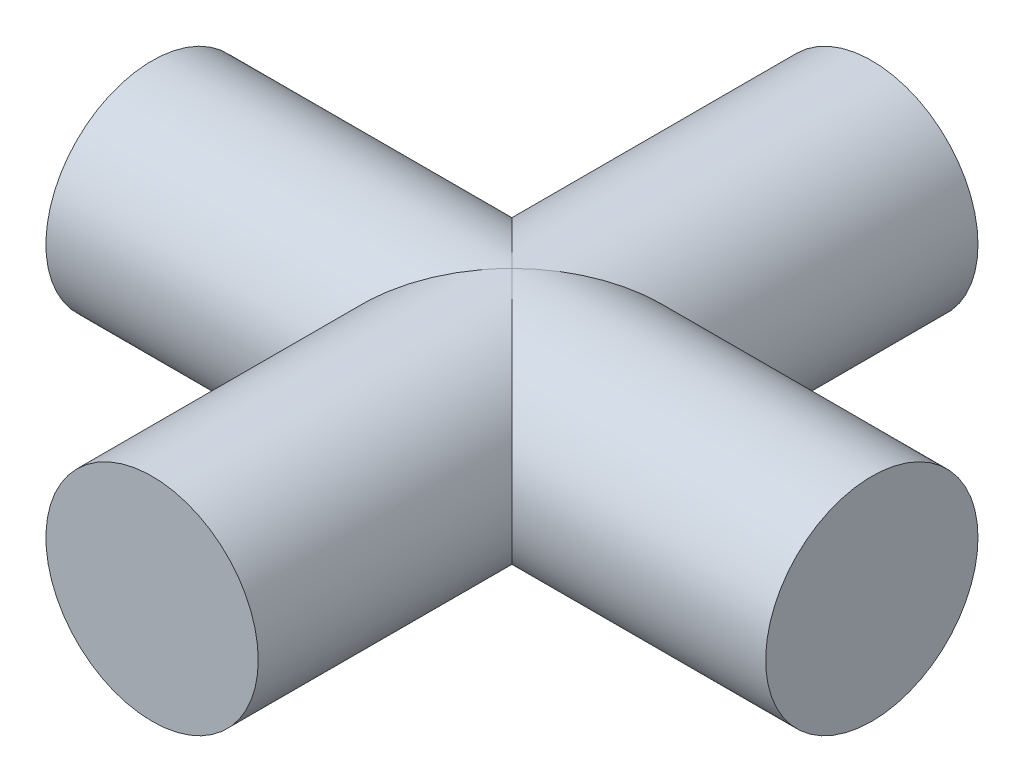
from build123d import *

# Parameters (mm, degrees)
SKETCH1_R           = 1.475
BOSS_EXTRUDE1_DEPTH = 5
SKETCH2_R           = 1.475
BOSS_EXTRUDE2_DEPTH = 5


with BuildPart() as part:
    # Sketch1 → Boss-Extrude1 (new, symmetric)
    with BuildSketch(Plane.XY):
        Circle(SKETCH1_R)
    extrude(amount=BOSS_EXTRUDE1_DEPTH, both=True)

    # Sketch2 → Boss-Extrude2 (add, symmetric)
    with BuildSketch(Plane(origin=(0, 0, 0), x_dir=(0, 0, -1), z_dir=(1, 0, 0))):
        Circle(SKETCH2_R)
    extrude(amount=BOSS_EXTRUDE2_DEPTH, both=True)


solid = part.part
